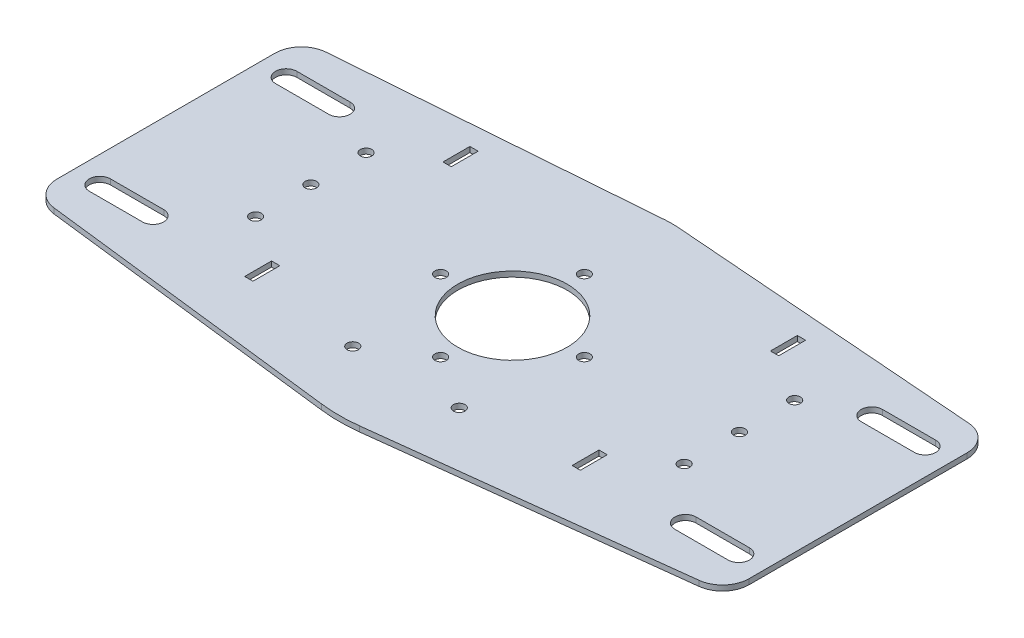
from build123d import *

# Parameters (mm, degrees)
SKETCH1_R                = 20.55
SKETCH1_R_2              = 1
SKETCH1_W                = 3.1
SKETCH1_H                = 10.1
BASE_FLANGE1_DEPTH       = 2
FILLET1_R                = 10
M4_CLEARANCE_HOLE2_D     = 4.3
M4_CLEARANCE_HOLE2_DEPTH = 136
M4_CLEARANCE_HOLE2_TIP   = 1.291850331


# Sheet-metal steps are written as plain solids
with BuildPart() as part:
    # Sketch1 → Base-Flange1 (new body)
    with BuildSketch(Plane(origin=(0, 0, 0), x_dir=(1, 0, 0), z_dir=(0, 1, 0))):
        with BuildLine():
            Line((-130, -50), (-130, 50))
            Line((-130, 50), (-2.300894967, 59.823008079))
            ThreePointArc((-2.300894967, 59.823008079), (0, 59.911373514), (2.300894967, 59.823008079))
            Line((2.300894967, 59.823008079), (130, 50))
            Line((130, 50), (130, -50))
            Line((130, -50), (7.067672556, -64.582279284))
            ThreePointArc((7.067672556, -64.582279284), (0, -65), (-7.067672556, -64.582279284))
            Line((-7.067672556, -64.582279284), (-130, -50))
        make_face()
        with Locations(Location((0, 0, 0), (0, 0, 270))):
            Circle(SKETCH1_R, mode=Mode.SUBTRACT)
        with Locations(Location((0, 27, 0), (0, 0, 270))):
            Circle(SKETCH1_R_2, mode=Mode.SUBTRACT)
        with Locations(Location((-80.5, 25.5, 0), (0, 0, 270))):
            Circle(SKETCH1_R_2, mode=Mode.SUBTRACT)
        with Locations(Location((-80.5, 4.75, 0), (0, 0, 270))):
            Circle(SKETCH1_R_2, mode=Mode.SUBTRACT)
        with Locations(Location((-80.5, -16, 0), (0, 0, 270))):
            Circle(SKETCH1_R_2, mode=Mode.SUBTRACT)
        with Locations(Location((80.5, -16, 0), (0, 0, 90))):
            Circle(SKETCH1_R_2, mode=Mode.SUBTRACT)
        with Locations(Location((80.5, 4.75, 0), (0, 0, 90))):
            Circle(SKETCH1_R_2, mode=Mode.SUBTRACT)
        with Locations(Location((80.5, 25.5, 0), (0, 0, 90))):
            Circle(SKETCH1_R_2, mode=Mode.SUBTRACT)
        with Locations(Location((27, 0, 0), (0, 0, 270))):
            Circle(SKETCH1_R_2, mode=Mode.SUBTRACT)
        with Locations(Location((0, -27, 0), (0, 0, 270))):
            Circle(SKETCH1_R_2, mode=Mode.SUBTRACT)
        with Locations(Location((-27, 0, 0), (0, 0, 270))):
            Circle(SKETCH1_R_2, mode=Mode.SUBTRACT)
        with Locations(Location((20, -40, 0), (0, 0, 270))):
            Circle(SKETCH1_R_2, mode=Mode.SUBTRACT)
        with Locations(Location((-20, -40, 0), (0, 0, 270))):
            Circle(SKETCH1_R_2, mode=Mode.SUBTRACT)
        with Locations((-61.5, 42)):
            Rectangle(SKETCH1_W, SKETCH1_H, mode=Mode.SUBTRACT)
        with Locations((-61.5, -32.5)):
            Rectangle(SKETCH1_W, SKETCH1_H, mode=Mode.SUBTRACT)
        with Locations((61.5, -32.5)):
            Rectangle(SKETCH1_W, SKETCH1_H, mode=Mode.SUBTRACT)
        with Locations((61.5, 42)):
            Rectangle(SKETCH1_W, SKETCH1_H, mode=Mode.SUBTRACT)
        with BuildLine():
            Line((-120, 39), (-100, 39))
            ThreePointArc((-100, 39), (-96, 35), (-100, 31))
            Line((-100, 31), (-120, 31))
            ThreePointArc((-120, 31), (-124, 35), (-120, 39))
        make_face(mode=Mode.SUBTRACT)
        with BuildLine():
            Line((120, 39), (100, 39))
            ThreePointArc((100, 39), (96, 35), (100, 31))
            Line((100, 31), (120, 31))
            ThreePointArc((120, 31), (124, 35), (120, 39))
        make_face(mode=Mode.SUBTRACT)
        with BuildLine():
            Line((120, -39), (100, -39))
            ThreePointArc((100, -39), (96, -35), (100, -31))
            Line((100, -31), (120, -31))
            ThreePointArc((120, -31), (124, -35), (120, -39))
        make_face(mode=Mode.SUBTRACT)
        with BuildLine():
            Line((-120, -39), (-100, -39))
            ThreePointArc((-100, -39), (-96, -35), (-100, -31))
            Line((-100, -31), (-120, -31))
            ThreePointArc((-120, -31), (-124, -35), (-120, -39))
        make_face(mode=Mode.SUBTRACT)
    extrude(amount=-BASE_FLANGE1_DEPTH)

    # Fillet1
    fillet1_edges = [part.edges().sort_by_distance(p)[0] for p in [
        (130, -1, -50),
        (130, -1, 50),
        (-130, -1, 50),
        (-130, -1, -50),
    ]]
    fillet(fillet1_edges, radius=FILLET1_R)

    # M4 Clearance Hole2
    with Locations(Plane(origin=(0, 0, 0), x_dir=(1, 0, 0), z_dir=(0, 1, 0))):
        with Locations((-27, 0), (0, 27), (27, 0), (0, -27), (20, -40), (-20, -40), (80.5, -16), (80.5, 25.5), (80.5, 4.75), (-80.5, 25.5), (-80.5, 4.75), (-80.5, -16)):
            Hole(M4_CLEARANCE_HOLE2_D / 2, depth=M4_CLEARANCE_HOLE2_DEPTH)
            with Locations((0, 0, -(M4_CLEARANCE_HOLE2_DEPTH + M4_CLEARANCE_HOLE2_TIP / 2))):  # 118° drill point
                Cone(0, M4_CLEARANCE_HOLE2_D / 2, M4_CLEARANCE_HOLE2_TIP, mode=Mode.SUBTRACT)


solid = part.part
